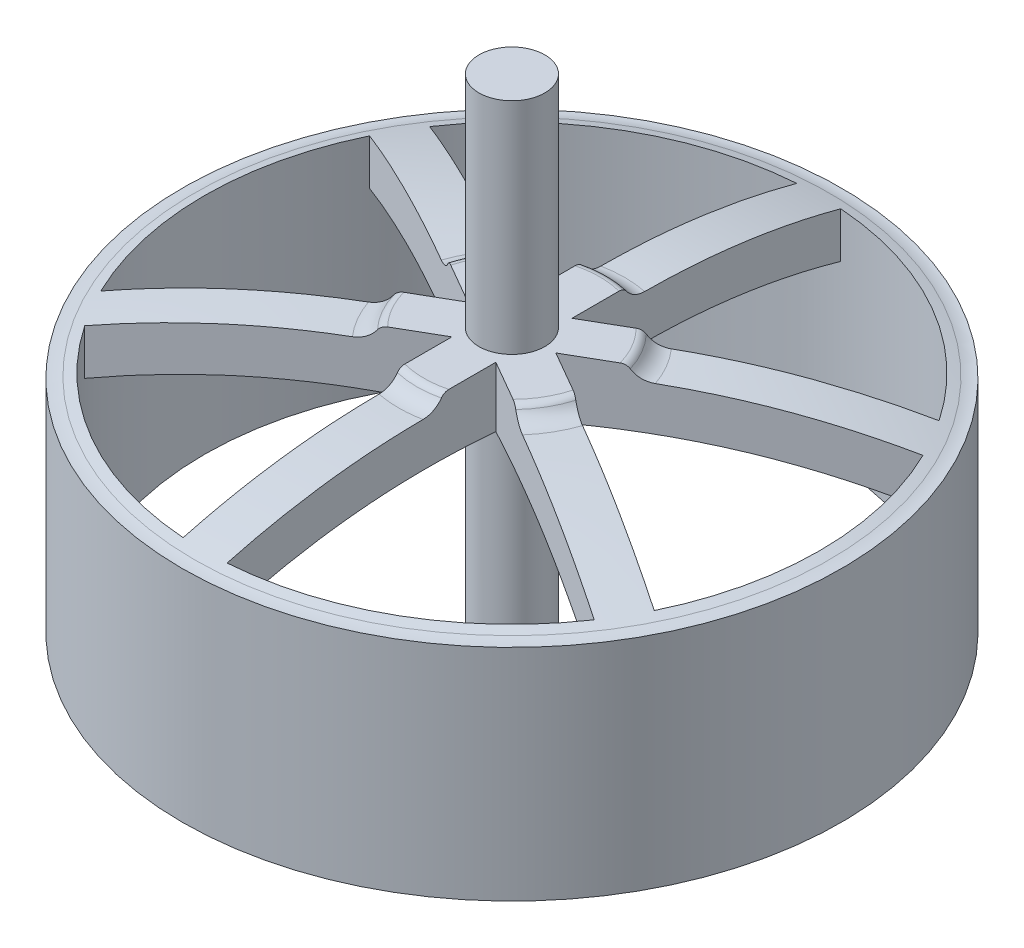
from build123d import *
from build123d.topology import SkipClean

# Parameters (mm, degrees)
ESBO_O1_R                = 7.5
RESSALTO_EXTRUS_O1_DEPTH = 6
ESBO_O4_R                = 0.75
RESSALTO_EXTRUS_O2_DEPTH = 5
RESSALTO_EXTRUS_O3_START = -6
ESBO_O4_2_R              = 0.75
RESSALTO_EXTRUS_O3_DEPTH = 6


# Read off the part's stored shape, not the designer's step: Corte-extrusão1
with BuildPart() as part:
    # Esboço1 → Ressalto-extrusão1 (new body)
    with BuildSketch(Plane(origin=(0, 0, 0), x_dir=(1, 0, 0), z_dir=(0, 1, 0))):
        with Locations(Location((0, 0, 0), (0, 0, 270))):
            Circle(ESBO_O1_R)
        with BuildLine():
            ThreePointArc((-0.5, 6.982120022), (-3.5, 6.062177826), (-5.796693311, 3.924072713))
            Line((-5.796693311, 3.924072713), (-0.5, 0.866025404))
            Line((-0.5, 0.866025404), (-0.5, 6.982120022))
        make_face(mode=Mode.SUBTRACT)
        with BuildLine():
            ThreePointArc((-6.296693311, 3.058047309), (-7, 0), (-6.296693311, -3.058047309))
            Line((-6.296693311, -3.058047309), (-1, 0))
            Line((-1, 0), (-6.296693311, 3.058047309))
        make_face(mode=Mode.SUBTRACT)
        with BuildLine():
            ThreePointArc((-5.796693311, -3.924072713), (-3.5, -6.062177826), (-0.5, -6.982120022))
            Line((-0.5, -6.982120022), (-0.5, -0.866025404))
            Line((-0.5, -0.866025404), (-5.796693311, -3.924072713))
        make_face(mode=Mode.SUBTRACT)
        with BuildLine():
            ThreePointArc((0.5, -6.982120022), (3.5, -6.062177826), (5.796693311, -3.924072713))
            Line((5.796693311, -3.924072713), (0.5, -0.866025404))
            Line((0.5, -0.866025404), (0.5, -6.982120022))
        make_face(mode=Mode.SUBTRACT)
        with BuildLine():
            ThreePointArc((6.296693311, -3.058047309), (7, 0), (6.296693311, 3.058047309))
            Line((6.296693311, 3.058047309), (1, 0))
            Line((1, 0), (6.296693311, -3.058047309))
        make_face(mode=Mode.SUBTRACT)
        with BuildLine():
            ThreePointArc((5.796693311, 3.924072713), (3.5, 6.062177826), (0.5, 6.982120022))
            Line((0.5, 6.982120022), (0.5, 0.866025404))
            Line((0.5, 0.866025404), (5.796693311, 3.924072713))
        make_face(mode=Mode.SUBTRACT)
    extrude(amount=RESSALTO_EXTRUS_O1_DEPTH)

    # Esboço2 → Corte-Revolução2 (revolve, cut)
    with BuildSketch(Plane.XY, mode=Mode.PRIVATE) as corte_revolu_o2_sk:
        with BuildLine():
            Line((0, 6), (2, 6))
            ThreePointArc((2, 6), (2.092582968, 5.977280552), (2.164131597, 5.91428394))
            ThreePointArc((2.164131597, 5.91428394), (2.341899473, 5.757370556), (2.571968696, 5.7))
            ThreePointArc((2.571968696, 5.7), (4.921587466, 5.527909221), (7.226053236, 5.038255143))
            ThreePointArc((7.226053236, 5.038255143), (7.361697537, 5.009609961), (7.5, 5))
            Line((7.5, 5), (7.5, 6))
            Line((7.5, 6), (3.255716965, 8.089006722))
            Line((3.255716965, 8.089006722), (0, 7.968601294))
            Line((0, 7.968601294), (0, 6))
        make_face()
    revolve(corte_revolu_o2_sk.sketch.rotate(Axis((0, 7.968601294, 0), (0, -1, 0)), 90), axis=Axis((0, 7.968601294, 0), (0, -1, 0)), mode=Mode.SUBTRACT)

    # Corte-extrusão1 outline → Corte-extrusão1 (revolve, cut)
    with SkipClean():  # the faces are left unmerged after this step: merging them gives an invalid solid
        with BuildSketch(Plane.XY):
            with BuildLine():
                Line((7, 0), (7.000000001, 4.062788978))
                add(Edge.make_bspline(
                    [(7.000000001, 4.062788978), (3.549209955, 5.057134335), (0, 4.50960961)],
                    knots=[1.290246178, 1.290246178, 1.290246178, 1.723856401, 1.723856401, 1.723856401], degree=2, weights=[1, 0.976589687, 1]))
                Line((0, 4.50960961), (0, 0))
                Line((0, 0), (7, 0))
            make_face()
        revolve(axis=Axis((0, 0, 0), (0, 1, 0)), mode=Mode.SUBTRACT)

    # Esboço4 → Ressalto-extrusão2 (add)
    with SkipClean():  # the faces are left unmerged after this step: merging them gives an invalid solid
        with BuildSketch(Plane(origin=(0, 6, 0), x_dir=(1, 0, 0), z_dir=(0, 1, 0))):
            with Locations(Location((0, 0, 0), (0, 0, 270))):
                Circle(ESBO_O4_R)
        extrude(amount=RESSALTO_EXTRUS_O2_DEPTH)

    # Esboço4<2> → Ressalto-extrusão3 (add)
    with SkipClean():  # the faces are left unmerged after this step: merging them gives an invalid solid
        with BuildSketch(Plane(origin=(0, 6, 0), x_dir=(1, 0, 0), z_dir=(0, 1, 0)).offset(RESSALTO_EXTRUS_O3_START)):
            with Locations(Location((0, 0, 0), (0, 0, 270))):
                Circle(ESBO_O4_2_R)
        extrude(amount=RESSALTO_EXTRUS_O3_DEPTH)


solid = part.part
